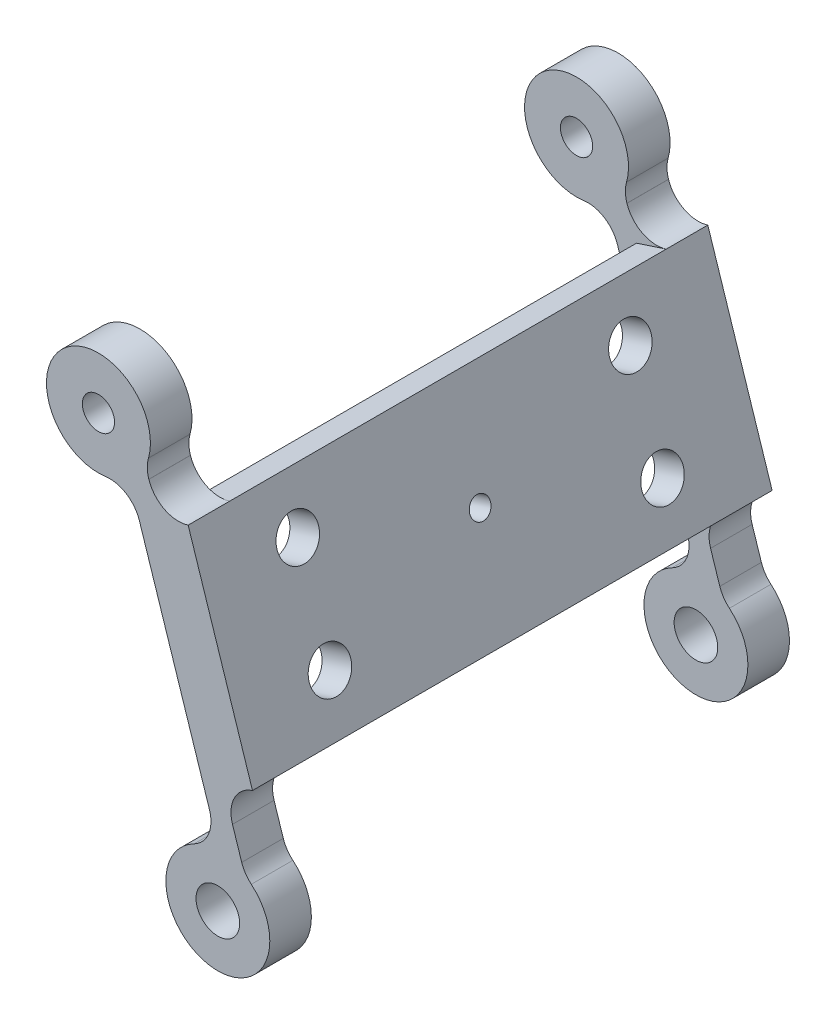
from build123d import *

# Parameters (mm, degrees)
SKETCH1_R           = 2.1
SKETCH1_R_2         = 1.55
BOSS_EXTRUDE1_DEPTH = 4
BOSS_EXTRUDE2_DEPTH = 50
SKETCH3_R           = 2
SKETCH3_R_2         = 1
CUT_EXTRUDE1_DEPTH  = 10
FILLET1_R           = 3


with BuildPart() as part:
    # Sketch1 → Boss-Extrude1 (new body)
    with BuildSketch(Plane.XY):
        with BuildLine():
            Line((-7.842362425, 10.716234493), (-17.397624454, 40.071064625))
            ThreePointArc((-17.397624454, 40.071064625), (-25.795005306, 45.357497095), (-18.956793202, 38.167140452))
            Line((-18.956793202, 38.167140452), (-18.754238897, 37.544871045))
            Line((-18.754238897, 37.544871045), (-10.63810017, 12.611188123))
            Line((-10.63810017, 12.611188123), (-10.256851829, 11.439950722))
            ThreePointArc((-10.256851829, 11.439950722), (-11.874437039, 1.653788416), (-7.842362425, 10.716234493))
        make_face()
        with Locations((-10.438845238, 6.44326398)):
            Circle(SKETCH1_R, mode=Mode.SUBTRACT)
        with Locations((-21.926625837, 42.189589224)):
            Circle(SKETCH1_R_2, mode=Mode.SUBTRACT)
    boss_extrude1 = extrude(amount=BOSS_EXTRUDE1_DEPTH)

    # Sketch2 → Boss-Extrude2 (add)
    with BuildSketch(Plane.XY.offset(4)):
        Polygon((-16.14843876, 36.233426921), (-9.957962302, 17.215593153), (-7.105287237, 18.144164622), (-13.295763695, 37.161998389), align=None)
    extrude(amount=-BOSS_EXTRUDE2_DEPTH)

    # Mirror1: Boss-Extrude1 across plane
    add(boss_extrude1.mirror(Plane.XY.offset(-21)))

    # Sketch3 → Cut-Extrude1 (cut)
    with BuildSketch(Plane(origin=(-3.936983875, -1.281523768, 0), x_dir=(0, 0, 1), z_dir=(-0.950891688393093, -0.30952382290371966, 0))):
        with Locations(Location((-5, 34.452391, 0), (0, 0, 270))):
            Circle(SKETCH3_R)
        with Locations(Location((-5, 24.452391, 0), (0, 0, 90))):
            Circle(SKETCH3_R)
        with Locations(Location((-37, 24.452391, 0), (0, 0, 270))):
            Circle(SKETCH3_R)
        with Locations(Location((-37, 34.452391, 0), (0, 0, 90))):
            Circle(SKETCH3_R)
        with Locations(Location((-21, 29.452391, 0), (0, 0, 270))):
            Circle(SKETCH3_R_2)
    extrude(amount=-CUT_EXTRUDE1_DEPTH, mode=Mode.SUBTRACT)

    # Fillet1
    fillet1_edges = [part.edges().sort_by_distance(p)[0] for p in [
        (-9.957962302, 17.215593153, 2),
        (-9.957962302, 17.215593153, -44),
        (-16.14843876, 36.233426921, -44),
        (-16.14843876, 36.233426921, 2),
        (-10.256851829, 11.439950722, 2),
        (-7.842362425, 10.716234493, 2),
        (-7.842362425, 10.716234493, -44),
        (-10.256851829, 11.439950722, -44),
        (-17.397624454, 40.071064625, -44),
        (-18.956793202, 38.167140452, -44),
        (-17.397624454, 40.071064625, 2),
        (-18.956793202, 38.167140452, 2),
    ]]
    fillet(fillet1_edges, radius=FILLET1_R - 0.0001)  # a hair under: the kernel refuses the full size


solid = part.part
